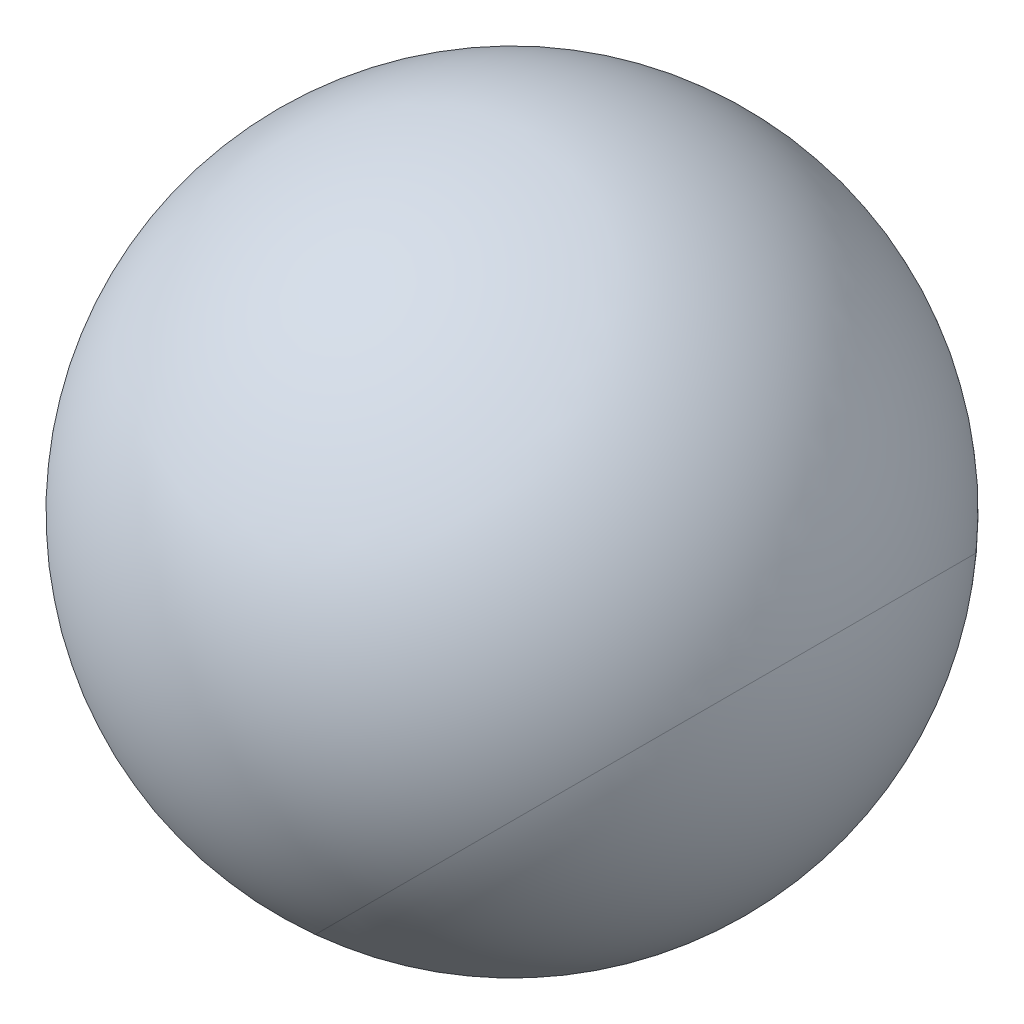
from build123d import *


with BuildPart() as part:
    # Sketch1 → Revolve1 (revolve)
    with BuildSketch(Plane.XY):
        with BuildLine():
            Line((3.888063673, 9.38661605), (19.440318364, 46.933080252))
            ThreePointArc((19.440318364, 46.933080252), (-7.109041082, 35.935975497), (3.888063673, 9.38661605))
        make_face()
    revolve(axis=Axis((3.888063673, 9.38661605, 0), (0.3826834323650907, 0.9238795325112864, 0)))


with BuildPart() as body_2:
    # Intersect2: read off the stored shape, not the designer's step
    # Intersect2: the piece on the far side of the plane
    add(part.part)
    split(bisect_by=Plane(origin=(0, 0, 0), x_dir=(0.707106781186549, 0.707106781186546, 0), z_dir=(0.707106781186546, -0.707106781186549, 0)), keep=Keep.BOTTOM)


with BuildPart() as part_1:
    add(part.part)

    # Intersect2
    split(bisect_by=Plane(origin=(0, 0, 0), x_dir=(0.707106781186549, 0.707106781186546, 0), z_dir=(0.707106781186546, -0.707106781186549, 0)), keep=Keep.TOP)


solid = Compound([body_2.part, part_1.part])
